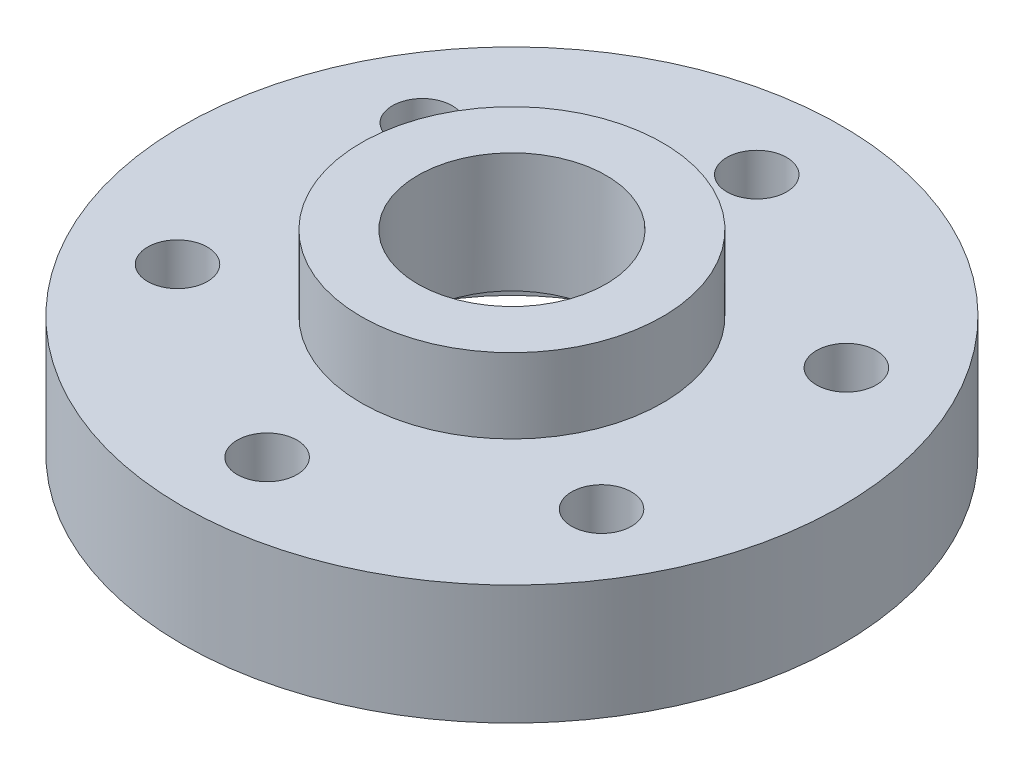
from build123d import *

# Parameters (mm, degrees)
SKETCH1_R           = 35
SKETCH1_R_2         = 10
BOSS_EXTRUDE1_DEPTH = 12.7
BOSS_EXTRUDE2_START = 7.9375
SKETCH2_R           = 16
SKETCH2_R_2         = 10
BOSS_EXTRUDE2_DEPTH = 7.9375
SKETCH3_R           = 20.6375
CUT_EXTRUDE1_DEPTH  = 7.9375
SKETCH4_R           = 3.175
CUT_EXTRUDE2_DEPTH  = 54.62747809
CIRPATTERN1_COUNT   = 6


with BuildPart() as part:
    # Sketch1 → Boss-Extrude1 (new body)
    with BuildSketch(Plane(origin=(0, 0, 0), x_dir=(1, 0, 0), z_dir=(0, 1, 0))):
        Circle(SKETCH1_R)
        Circle(SKETCH1_R_2, mode=Mode.SUBTRACT)
    extrude(amount=-BOSS_EXTRUDE1_DEPTH)

    # Sketch2 → Boss-Extrude2 (add)
    with BuildSketch(Plane(origin=(0, 0, 0), x_dir=(1, 0, 0), z_dir=(0, 1, 0)).offset(BOSS_EXTRUDE2_START)):
        Circle(SKETCH2_R)
        Circle(SKETCH2_R_2, mode=Mode.SUBTRACT)
    extrude(amount=-BOSS_EXTRUDE2_DEPTH)

    # Sketch3 → Cut-Extrude1 (cut)
    with BuildSketch(Plane.XZ.offset(12.7)):
        Circle(SKETCH3_R)
    extrude(amount=-CUT_EXTRUDE1_DEPTH, mode=Mode.SUBTRACT)

    # Sketch4 → Cut-Extrude2 (cut, through all)
    with BuildSketch(Plane.XZ.offset(12.7)):
        with Locations((0, 26)):
            Circle(SKETCH4_R)
    cut_extrude2 = extrude(amount=-CUT_EXTRUDE2_DEPTH, mode=Mode.SUBTRACT)

    # CirPattern1: Cut-Extrude2 ×6 about axis
    cirpattern1_axis = Axis((0, -12.7, 0), (0, -1, 0))
    for i in range(1, CIRPATTERN1_COUNT):
        add(cut_extrude2.rotate(cirpattern1_axis, i * 360 / CIRPATTERN1_COUNT), mode=Mode.SUBTRACT)


solid = part.part
